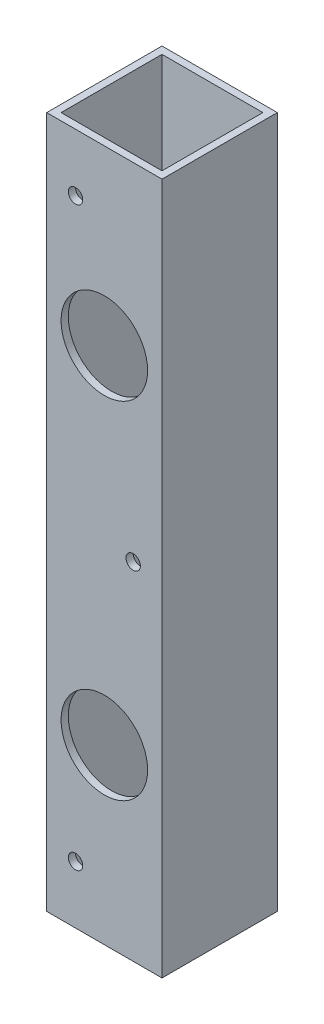
from build123d import *

# Parameters (mm, degrees)
SKETCH1_W           = 25.4
SKETCH1_H           = 25.4
SKETCH1_W_2         = 22.225
SKETCH1_H_2         = 22.225
EXTRUDE_THIN1_DEPTH = 152.4
CUT_EXTRUDE1_REACH  = 157.023
SKETCH2_R           = 9.525
SKETCH2_R_2         = 1.5875
SKETCH4_R           = 3.3782
CUT_EXTRUDE2_DEPTH  = 155.771073383


with BuildPart() as part:
    # Sketch1 → Extrude-Thin1 (new body)
    with BuildSketch(Plane(origin=(0, 0, 0), x_dir=(1, 0, 0), z_dir=(0, 1, 0))):
        Rectangle(SKETCH1_W, SKETCH1_H)
        Rectangle(SKETCH1_W_2, SKETCH1_H_2, mode=Mode.SUBTRACT)
    extrude(amount=EXTRUDE_THIN1_DEPTH)

    # Sketch2 → Cut-Extrude1 (cut, up to next)
    with BuildSketch(Plane.XY.offset(12.7), mode=Mode.PRIVATE) as cut_extrude1_sk1:
        with Locations((0, 114.3)):
            Circle(SKETCH2_R)
    cut_extrude1_tool1 = extrude(cut_extrude1_sk1.sketch, amount=-CUT_EXTRUDE1_REACH, mode=Mode.PRIVATE) & part.part
    # Sketch2 → Cut-Extrude1 (cut, up to next)
    with BuildSketch(Plane.XY.offset(12.7), mode=Mode.PRIVATE) as cut_extrude1_sk2:
        with Locations((0, 38.1)):
            Circle(SKETCH2_R)
    cut_extrude1_tool2 = extrude(cut_extrude1_sk2.sketch, amount=-CUT_EXTRUDE1_REACH, mode=Mode.PRIVATE) & part.part
    # Sketch2 → Cut-Extrude1 (cut, up to next)
    with BuildSketch(Plane.XY.offset(12.7), mode=Mode.PRIVATE) as cut_extrude1_sk3:
        with Locations((-6.35, 139.7)):
            Circle(SKETCH2_R_2)
    cut_extrude1_tool3 = extrude(cut_extrude1_sk3.sketch, amount=-CUT_EXTRUDE1_REACH, mode=Mode.PRIVATE) & part.part
    # Sketch2 → Cut-Extrude1 (cut, up to next)
    with BuildSketch(Plane.XY.offset(12.7), mode=Mode.PRIVATE) as cut_extrude1_sk4:
        with Locations((6.35, 76.2)):
            Circle(SKETCH2_R_2)
    cut_extrude1_tool4 = extrude(cut_extrude1_sk4.sketch, amount=-CUT_EXTRUDE1_REACH, mode=Mode.PRIVATE) & part.part
    # Sketch2 → Cut-Extrude1 (cut, up to next)
    with BuildSketch(Plane.XY.offset(12.7), mode=Mode.PRIVATE) as cut_extrude1_sk5:
        with Locations((-6.35, 12.7)):
            Circle(SKETCH2_R_2)
    cut_extrude1_tool5 = extrude(cut_extrude1_sk5.sketch, amount=-CUT_EXTRUDE1_REACH, mode=Mode.PRIVATE) & part.part
    add(cut_extrude1_tool1.solids().sort_by_distance((0, 114.3, 12.7))[0], mode=Mode.SUBTRACT)
    add(cut_extrude1_tool2.solids().sort_by_distance((0, 38.1, 12.7))[0], mode=Mode.SUBTRACT)
    add(cut_extrude1_tool3.solids().sort_by_distance((-6.35, 139.7, 12.7))[0], mode=Mode.SUBTRACT)
    add(cut_extrude1_tool4.solids().sort_by_distance((6.35, 76.2, 12.7))[0], mode=Mode.SUBTRACT)
    add(cut_extrude1_tool5.solids().sort_by_distance((-6.35, 12.7, 12.7))[0], mode=Mode.SUBTRACT)

    # Sketch4 → Cut-Extrude2 (cut, through all)
    with BuildSketch(Plane.XY.offset(-11.1125)):
        with Locations((0, 114.3)):
            Circle(SKETCH4_R)
        with Locations((0, 38.1)):
            Circle(SKETCH4_R)
    extrude(amount=-CUT_EXTRUDE2_DEPTH, mode=Mode.SUBTRACT)


solid = part.part
